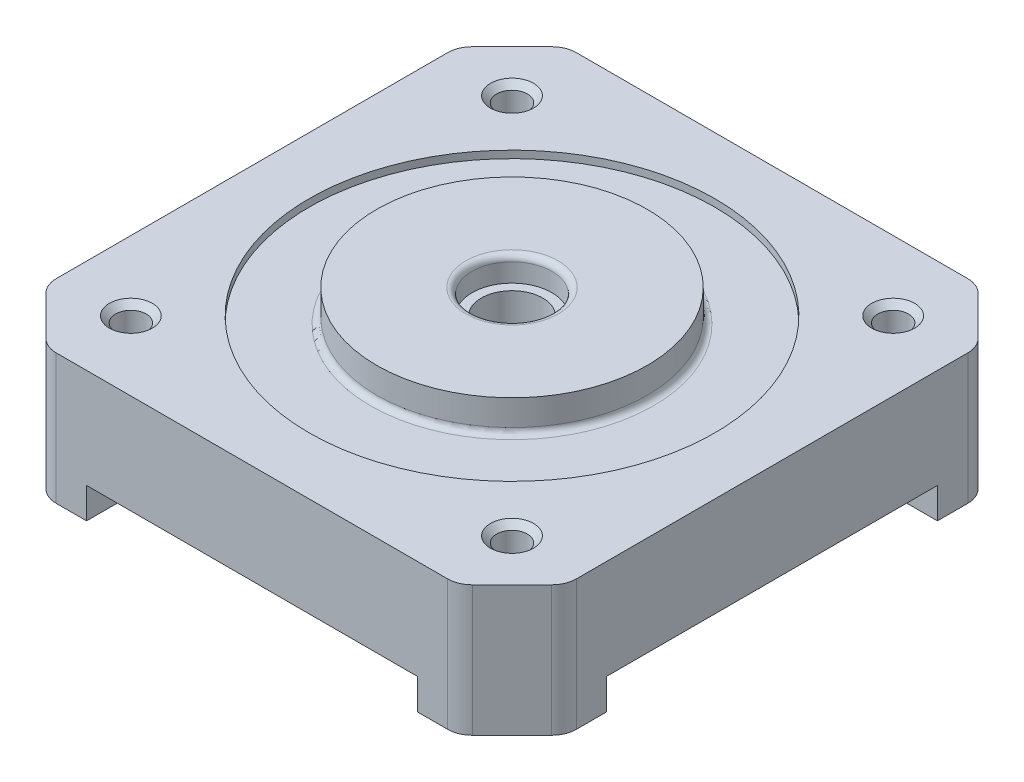
from build123d import *

# Parameters (mm, degrees)
BOSS_EXTRUDE1_DEPTH             = 10.6
SKETCH2_R                       = 16.5
CUT_EXTRUDE1_DEPTH              = 0.6
SKETCH3_R                       = 11
BOSS_EXTRUDE2_DEPTH             = 2.6
SKETCH4_R                       = 3.25
CUT_EXTRUDE2_DEPTH              = 2
SKETCH5_R                       = 2.5
CUT_EXTRUDE3_DEPTH              = 32.733342087
FILLET1_R                       = 0.5
FILLET2_R                       = 0.5
M3X0_5_TAPPED_HOLE1_D           = 2.5
M3X0_5_TAPPED_HOLE1_DEPTH       = 10
M3X0_5_TAPPED_HOLE1_CSINK_D     = 3.5
M3X0_5_TAPPED_HOLE1_CSINK_ANGLE = 90
M3X0_5_TAPPED_HOLE1_TIP         = 0.751075774
SKETCH10_W                      = 26.901846944
SKETCH10_H                      = 2.5
CUT_EXTRUDE4_DEPTH              = 49.942542844
SKETCH11_W                      = 26.901846944
SKETCH11_H                      = 2.5
CUT_EXTRUDE5_DEPTH              = 49.942542844
FILLET3_R                       = 2


with BuildPart() as part:
    # Sketch1 → Boss-Extrude1 (new body)
    with BuildSketch(Plane(origin=(0, 0, 0), x_dir=(1, 0, 0), z_dir=(0, 1, 0))):
        Polygon((-21.15, 16.750923472), (-16.750923472, 21.15), (16.750923472, 21.15), (21.15, 16.750923472), (21.15, -16.750923472), (16.750923472, -21.15), (-16.750923472, -21.15), (-21.15, -16.750923472), align=None)
    extrude(amount=BOSS_EXTRUDE1_DEPTH)

    # Sketch2 → Cut-Extrude1 (cut)
    with BuildSketch(Plane(origin=(0, 10.6, 0), x_dir=(1, 0, 0), z_dir=(0, 1, 0))):
        Circle(SKETCH2_R)
    extrude(amount=-CUT_EXTRUDE1_DEPTH, mode=Mode.SUBTRACT)

    # Sketch3 → Boss-Extrude2 (add)
    with BuildSketch(Plane(origin=(0, 10, 0), x_dir=(1, 0, 0), z_dir=(0, 1, 0))):
        Circle(SKETCH3_R)
    extrude(amount=BOSS_EXTRUDE2_DEPTH)

    # Sketch4 → Cut-Extrude2 (cut)
    with BuildSketch(Plane(origin=(0, 12.6, 0), x_dir=(1, 0, 0), z_dir=(0, 1, 0))):
        Circle(SKETCH4_R)
    extrude(amount=-CUT_EXTRUDE2_DEPTH, mode=Mode.SUBTRACT)

    # Sketch5 → Cut-Extrude3 (cut, through all)
    with BuildSketch(Plane(origin=(0, 10.6, 0), x_dir=(1, 0, 0), z_dir=(0, 1, 0))):
        Circle(SKETCH5_R)
    extrude(amount=-CUT_EXTRUDE3_DEPTH, mode=Mode.SUBTRACT)

    # Fillet1
    fillet1_edges = [part.edges().sort_by_distance(p)[0] for p in [
        (-3.25, 12.6, 0),
    ]]
    fillet(fillet1_edges, radius=FILLET1_R)

    # Fillet2
    fillet2_edges = [part.edges().sort_by_distance(p)[0] for p in [
        (-11, 10, 0),
    ]]
    fillet(fillet2_edges, radius=FILLET2_R)

    # M3x0.5 Tapped Hole1
    with Locations(Plane(origin=(0, 10.6, 0), x_dir=(1, 0, 0), z_dir=(0, 1, 0))):
        with Locations((-15.5, 15.5), (15.5, 15.5), (15.5, -15.5), (-15.5, -15.5)):
            CounterSinkHole(M3X0_5_TAPPED_HOLE1_D / 2, M3X0_5_TAPPED_HOLE1_CSINK_D / 2, depth=M3X0_5_TAPPED_HOLE1_DEPTH, counter_sink_angle=M3X0_5_TAPPED_HOLE1_CSINK_ANGLE)
            with Locations((0, 0, -(M3X0_5_TAPPED_HOLE1_DEPTH + M3X0_5_TAPPED_HOLE1_TIP / 2))):  # 118° drill point
                Cone(0, M3X0_5_TAPPED_HOLE1_D / 2, M3X0_5_TAPPED_HOLE1_TIP, mode=Mode.SUBTRACT)

    # Sketch10 → Cut-Extrude4 (cut, through all)
    with BuildSketch(Plane.XY.offset(21.15)):
        with Locations((0, 1.25)):
            Rectangle(SKETCH10_W, SKETCH10_H)
    extrude(amount=-CUT_EXTRUDE4_DEPTH, mode=Mode.SUBTRACT)

    # Sketch11 → Cut-Extrude5 (cut, through all)
    with BuildSketch(Plane.ZY.offset(21.15)):
        with Locations((0, 1.25)):
            Rectangle(SKETCH11_W, SKETCH11_H)
    extrude(amount=-CUT_EXTRUDE5_DEPTH, mode=Mode.SUBTRACT)

    # Fillet3
    fillet3_edges = [part.edges().sort_by_distance(p)[0] for p in [
        (-21.15, 5.3, 16.750923472),
        (16.750923472, 5.3, -21.15),
        (21.15, 5.3, -16.750923472),
        (21.15, 5.3, 16.750923472),
        (16.750923472, 5.3, 21.15),
        (-16.750923472, 5.3, 21.15),
        (-16.750923472, 5.3, -21.15),
        (-21.15, 5.3, -16.750923472),
    ]]
    fillet(fillet3_edges, radius=FILLET3_R)


solid = part.part
